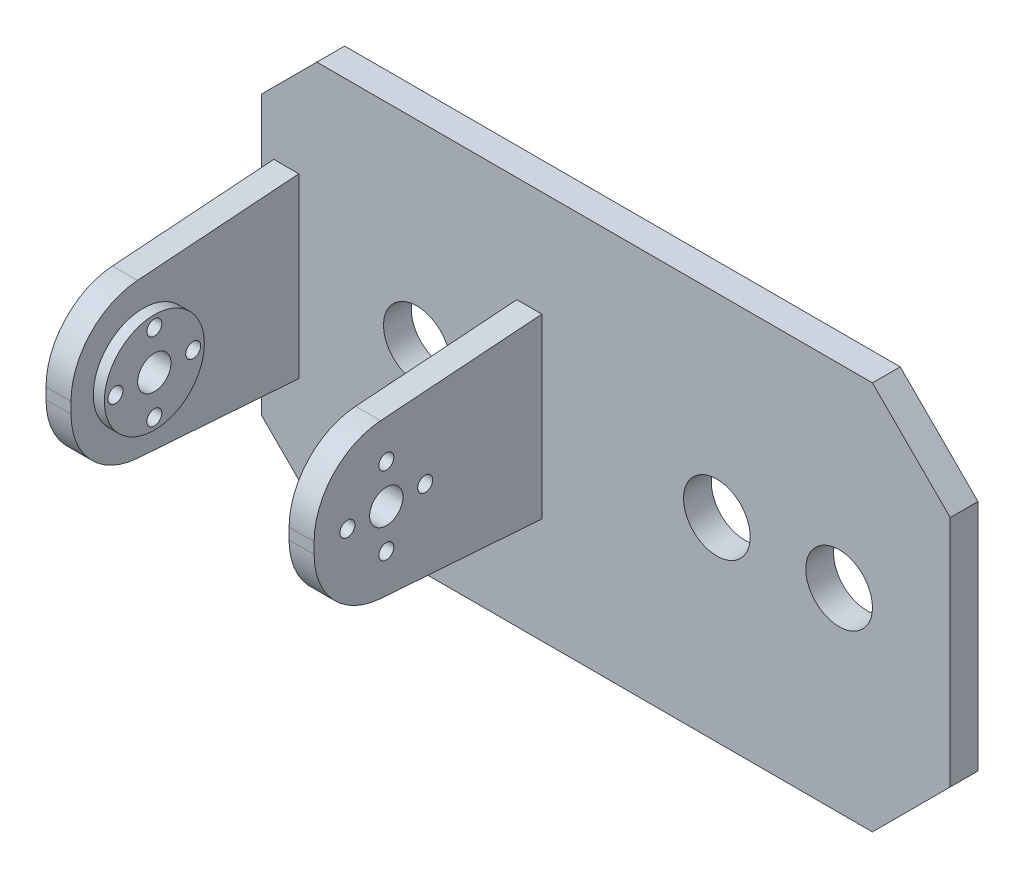
from build123d import *

# Parameters (mm, degrees)
BOSS_1_DEPTH  = 5
BOSS_2_DEPTH  = 4.5
S_CYL3_R      = 9
BOSS_3_DEPTH  = 2
BOSS_4_DEPTH  = 4.5
S_HOLE5_R     = 3
HOLE_5_DEPTH  = 4.7
S_HOLE6_R     = 1.35
HOLE_6_DEPTH  = 4.7
S_HOLE7_R     = 1.35
HOLE_7_DEPTH  = 4.7
S_HOLE8_R     = 1.35
HOLE_8_DEPTH  = 4.7
S_HOLE9_R     = 1.35
HOLE_9_DEPTH  = 4.7
S_HOLE10_R    = 3
HOLE_10_DEPTH = 6.7
S_HOLE11_R    = 1.35
HOLE_11_DEPTH = 6.7
S_HOLE12_R    = 1.35
HOLE_12_DEPTH = 6.7
S_HOLE13_R    = 1.35
HOLE_13_DEPTH = 6.7
S_HOLE14_R    = 1.35
HOLE_14_DEPTH = 6.7
S_HOLE15_R    = 6
HOLE_15_DEPTH = 5.2
S_HOLE16_R    = 6
HOLE_16_DEPTH = 5.2
S_HOLE17_R    = 6
HOLE_17_DEPTH = 5.2


with BuildPart() as part:
    # S_prism1 → Boss_1 (new body)
    with BuildSketch(Plane.XY.offset(-33)):
        Polygon((56, -21), (56, 21), (42, 35), (-58, 35), (-68, 25), (-68, -25), (-58, -35), (42, -35), align=None)
    extrude(amount=BOSS_1_DEPTH)

    # S_prism2 → Boss_2 (add)
    with BuildSketch(Plane(origin=(-22, 0, 0), x_dir=(0, 0, -1), z_dir=(1, 0, 0))):
        with BuildLine():
            Line((28.5, -16), (28.5, 16))
            Line((28.5, 16), (-1.0301, 13.8653))
            ThreePointArc((-1.0301, 13.8653), (-9.544808445, 9.785590923), (-13, 0.9989))
            Line((-13, 0.9989), (-13, -0.9989))
            ThreePointArc((-13, -0.9989), (-9.544808445, -9.785590923), (-1.0301, -13.8653))
            Line((-1.0301, -13.8653), (28.5, -16))
        make_face()
    extrude(amount=BOSS_2_DEPTH)



with BuildPart() as body_2:
    # S_cyl3 → Boss_3 (new body)
    with BuildSketch(Plane(origin=(-61.25, 0, 0), x_dir=(0, 0, -1), z_dir=(1, 0, 0))):
        Circle(S_CYL3_R)
    extrude(amount=BOSS_3_DEPTH)


with BuildPart() as part_1:
    add(part.part)

    add(body_2.part)  # Boss_4 merges body 2
    # S_prism4 → Boss_4 (add)
    with BuildSketch(Plane(origin=(-65.75, 0, 0), x_dir=(0, 0, -1), z_dir=(1, 0, 0))):
        with BuildLine():
            Line((28.5, -16), (28.5, 16))
            Line((28.5, 16), (-1.0301, 13.8653))
            ThreePointArc((-1.0301, 13.8653), (-9.544808445, 9.785590923), (-13, 0.9989))
            Line((-13, 0.9989), (-13, -0.9989))
            ThreePointArc((-13, -0.9989), (-9.544808445, -9.785590923), (-1.0301, -13.8653))
            Line((-1.0301, -13.8653), (28.5, -16))
        make_face()
    extrude(amount=BOSS_4_DEPTH)

    # S_hole5 → Hole_5 (cut)
    with BuildSketch(Plane(origin=(-22.1, 0, 0), x_dir=(0, 0, -1), z_dir=(1, 0, 0))):
        Circle(S_HOLE5_R)
    extrude(amount=HOLE_5_DEPTH, mode=Mode.SUBTRACT)

    # S_hole6 → Hole_6 (cut)
    with BuildSketch(Plane(origin=(-22.1, 0, 0), x_dir=(0, 0, -1), z_dir=(1, 0, 0))):
        with Locations((0, 7)):
            Circle(S_HOLE6_R)
    extrude(amount=HOLE_6_DEPTH, mode=Mode.SUBTRACT)

    # S_hole7 → Hole_7 (cut)
    with BuildSketch(Plane(origin=(-22.1, 0, 0), x_dir=(0, 0, -1), z_dir=(1, 0, 0))):
        with Locations((-7, 0)):
            Circle(S_HOLE7_R)
    extrude(amount=HOLE_7_DEPTH, mode=Mode.SUBTRACT)

    # S_hole8 → Hole_8 (cut)
    with BuildSketch(Plane(origin=(-22.1, 0, 0), x_dir=(0, 0, -1), z_dir=(1, 0, 0))):
        with Locations((0, -7)):
            Circle(S_HOLE8_R)
    extrude(amount=HOLE_8_DEPTH, mode=Mode.SUBTRACT)

    # S_hole9 → Hole_9 (cut)
    with BuildSketch(Plane(origin=(-22.1, 0, 0), x_dir=(0, 0, -1), z_dir=(1, 0, 0))):
        with Locations((7, 0)):
            Circle(S_HOLE9_R)
    extrude(amount=HOLE_9_DEPTH, mode=Mode.SUBTRACT)

    # S_hole10 → Hole_10 (cut)
    with BuildSketch(Plane(origin=(-65.85, 0, 0), x_dir=(0, 0, -1), z_dir=(1, 0, 0))):
        Circle(S_HOLE10_R)
    extrude(amount=HOLE_10_DEPTH, mode=Mode.SUBTRACT)

    # S_hole11 → Hole_11 (cut)
    with BuildSketch(Plane(origin=(-65.85, 0, 0), x_dir=(0, 0, -1), z_dir=(1, 0, 0))):
        with Locations((0, 7)):
            Circle(S_HOLE11_R)
    extrude(amount=HOLE_11_DEPTH, mode=Mode.SUBTRACT)

    # S_hole12 → Hole_12 (cut)
    with BuildSketch(Plane(origin=(-65.85, 0, 0), x_dir=(0, 0, -1), z_dir=(1, 0, 0))):
        with Locations((-7, 0)):
            Circle(S_HOLE12_R)
    extrude(amount=HOLE_12_DEPTH, mode=Mode.SUBTRACT)

    # S_hole13 → Hole_13 (cut)
    with BuildSketch(Plane(origin=(-65.85, 0, 0), x_dir=(0, 0, -1), z_dir=(1, 0, 0))):
        with Locations((0, -7)):
            Circle(S_HOLE13_R)
    extrude(amount=HOLE_13_DEPTH, mode=Mode.SUBTRACT)

    # S_hole14 → Hole_14 (cut)
    with BuildSketch(Plane(origin=(-65.85, 0, 0), x_dir=(0, 0, -1), z_dir=(1, 0, 0))):
        with Locations((7, 0)):
            Circle(S_HOLE14_R)
    extrude(amount=HOLE_14_DEPTH, mode=Mode.SUBTRACT)

    # S_hole15 → Hole_15 (cut)
    with BuildSketch(Plane.XY.offset(-33.1)):
        with Locations((-40, 0)):
            Circle(S_HOLE15_R)
    extrude(amount=HOLE_15_DEPTH, mode=Mode.SUBTRACT)

    # S_hole16 → Hole_16 (cut)
    with BuildSketch(Plane.XY.offset(-33.1)):
        with Locations((14, 0)):
            Circle(S_HOLE16_R)
    extrude(amount=HOLE_16_DEPTH, mode=Mode.SUBTRACT)

    # S_hole17 → Hole_17 (cut)
    with BuildSketch(Plane.XY.offset(-33.1)):
        with Locations((36, 0)):
            Circle(S_HOLE17_R)
    extrude(amount=HOLE_17_DEPTH, mode=Mode.SUBTRACT)


solid = part_1.part
